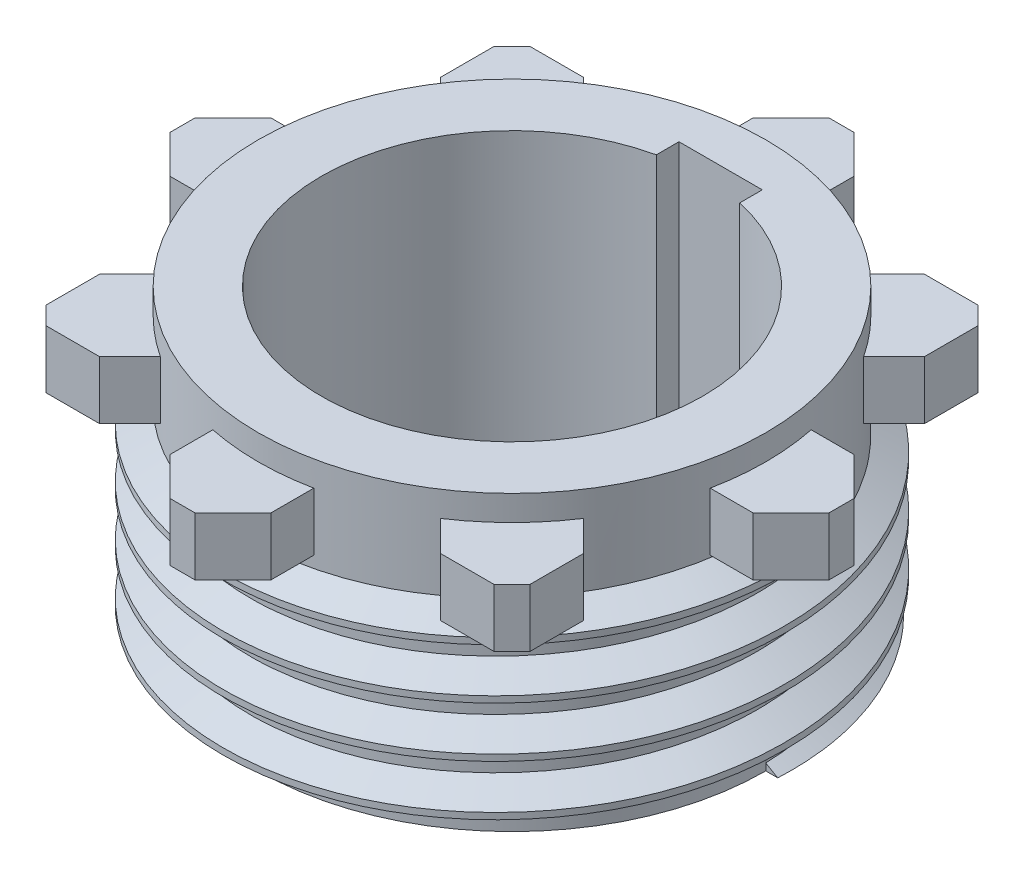
from build123d import *

# Parameters (mm, degrees)
CROQUIS1_R                = 10.05
SALIENTE_EXTRUIR2_DEPTH   = 11.6
CROQUIS3_W                = 4
CROQUIS3_H                = 2.3
SALIENTE_EXTRUIR3_DEPTH   = 1
CROQUIS22_W               = 4
CROQUIS22_H               = 2.3
SALIENTE_EXTRUIR4_DEPTH   = 3
CHAFL_N1_SIZE             = 1.5
MATRIZC7_COUNT            = 8
CHAFL_N1_OF_MATRIZC7_SIZE = 1.5
ROSCA2_PITCH              = 2
CROQUIS31_R               = 13.786585099
CORTAR_EXTRUIR1_DEPTH     = 2


with BuildPart() as part:
    # Croquis1 → Saliente-Extruir2 (new body)
    with BuildSketch(Plane(origin=(0, 0, 0), x_dir=(1, 0, 0), z_dir=(0, 1, 0))):
        with Locations(Location((0, 0, 0), (0, 0, 270))):
            Circle(CROQUIS1_R)
        with BuildLine():
            Line((-1.65, 8.262981214), (1.65, 8.262981214))
            Line((1.65, 8.262981214), (1.65, 7.367496183))
            ThreePointArc((1.65, 7.367496183), (0, -7.55), (-1.65, 7.367496183))
            Line((-1.65, 7.367496183), (-1.65, 8.262981214))
        make_face(mode=Mode.SUBTRACT)
    extrude(amount=SALIENTE_EXTRUIR2_DEPTH)

    # Croquis3 → Saliente-Extruir3 (add)
    with BuildSketch(Plane(origin=(10.05, 0, 0), x_dir=(0, 0, -1), z_dir=(1, 0, 0))):
        with Locations((0, 9.45)):
            Rectangle(CROQUIS3_W, CROQUIS3_H)
    saliente_extruir3 = extrude(amount=-SALIENTE_EXTRUIR3_DEPTH)

    # Croquis22 → Saliente-Extruir4 (add)
    with BuildSketch(Plane(origin=(10.05, 0, 0), x_dir=(0, 0, -1), z_dir=(1, 0, 0))):
        with Locations((0, 9.45)):
            Rectangle(CROQUIS22_W, CROQUIS22_H)
    saliente_extruir4 = extrude(amount=SALIENTE_EXTRUIR4_DEPTH)

    # Chaflán1
    chafl_n1_edges = [part.edges().sort_by_distance(p)[0] for p in [
        (13.05, 9.45, 2),
        (13.05, 9.45, -2),
    ]]
    chamfer(chafl_n1_edges, length=CHAFL_N1_SIZE)

    # MatrizC7: Saliente-Extruir3, Saliente-Extruir4 ×8 about axis
    matrizc7_axis = Axis((0, 0, 0), (0, 1, 0))
    add([saliente_extruir3.rotate(matrizc7_axis, i * 360 / MATRIZC7_COUNT) for i in range(1, MATRIZC7_COUNT)])
    add([saliente_extruir4.rotate(matrizc7_axis, i * 360 / MATRIZC7_COUNT) for i in range(1, MATRIZC7_COUNT)])

    # Chaflán1 of MatrizC7
    chafl_n1_of_matrizc7_edges = [part.edges().sort_by_distance(p)[0] for p in [
        (10.641957057, 9.45, -7.813529932),
        (7.813529932, 9.45, -10.641957057),
        (2, 9.45, -13.05),
        (-2, 9.45, -13.05),
        (-7.813529932, 9.45, -10.641957057),
        (-10.641957057, 9.45, -7.813529932),
        (-13.05, 9.45, -2),
        (-13.05, 9.45, 2),
        (-10.641957057, 9.45, 7.813529932),
        (-7.813529932, 9.45, 10.641957057),
        (-2, 9.45, 13.05),
        (2, 9.45, 13.05),
        (7.813529932, 9.45, 10.641957057),
        (10.641957057, 9.45, 7.813529932),
    ]]
    chamfer(chafl_n1_of_matrizc7_edges, length=CHAFL_N1_OF_MATRIZC7_SIZE)

    # Rosca2: the profile of Perfil de rosca3 profile screwed along a right-hand helix of 4 turns, 10 arcs to a turn; built about Z, then put on its axis
    rosca2_z = Axis((0, 0, 0), (0, 0, 1))
    rosca2_corners = [(10.0497, 0, -0.000173205), (11.11, 0, 0.611991285), (11.11, 0, 0.861991285), (10.0497, 0, 1.474155776)]
    with BuildLine(mode=Mode.PRIVATE) as rosca2_profile:
        Line(rosca2_corners[0], rosca2_corners[1])
        Line(rosca2_corners[1], rosca2_corners[2])
        Line(rosca2_corners[2], rosca2_corners[3])
        Line(rosca2_corners[3], rosca2_corners[0])
    rosca2_cap = Face(rosca2_profile.wire())
    rosca2_turn_angles = [0, 18, 36, 54, 72, 90, 108, 126, 144, 162, 180, 198, 216, 234, 252, 270, 288, 306, 324, 342, 360]
    rosca2_turn_weights = [1, 0.9510565162951535, 1, 0.9510565162951535, 1, 0.9510565162951535, 1, 0.9510565162951535, 1, 0.9510565162951535, 1, 0.9510565162951535, 1, 0.9510565162951535, 1, 0.9510565162951535, 1, 0.9510565162951535, 1, 0.9510565162951535, 1]
    rosca2_turn_rails = [Edge.make_bspline([Vector(p[0], p[1], 0).rotate(rosca2_z, rosca2_turn_angles[k]) / rosca2_turn_weights[k] + Vector(0, 0, p[2] + ROSCA2_PITCH * rosca2_turn_angles[k] / 360) for k in range(21)], [0, 0, 0, 1, 1, 2, 2, 3, 3, 4, 4, 5, 5, 6, 6, 7, 7, 8, 8, 9, 9, 10, 10, 10], 2, rosca2_turn_weights) for p in rosca2_corners]
    rosca2_turn_sides = [Face.make_surface_from_curves(rosca2_turn_rails[p[0]], rosca2_turn_rails[p[1]]) for p in [(0, 1), (1, 2), (2, 3), (3, 0)]]
    rosca2 = Plane(origin=(0, -1.2, 0), x_dir=(1, 0, 0), z_dir=(0, 1, 0)) * Solid(Shell([*[p.moved(Location((0, 0, ROSCA2_PITCH * i))) for i in range(4) for p in rosca2_turn_sides], rosca2_cap, rosca2_cap.rotate(rosca2_z, 1440).moved(Location((0, 0, ROSCA2_PITCH * 1440 / 360)))]))
    add(rosca2)

    # Croquis31 → Cortar-Extruir1 (cut)
    with BuildSketch(Plane.XZ):
        Circle(CROQUIS31_R)
    extrude(amount=CORTAR_EXTRUIR1_DEPTH, mode=Mode.SUBTRACT)


solid = part.part
